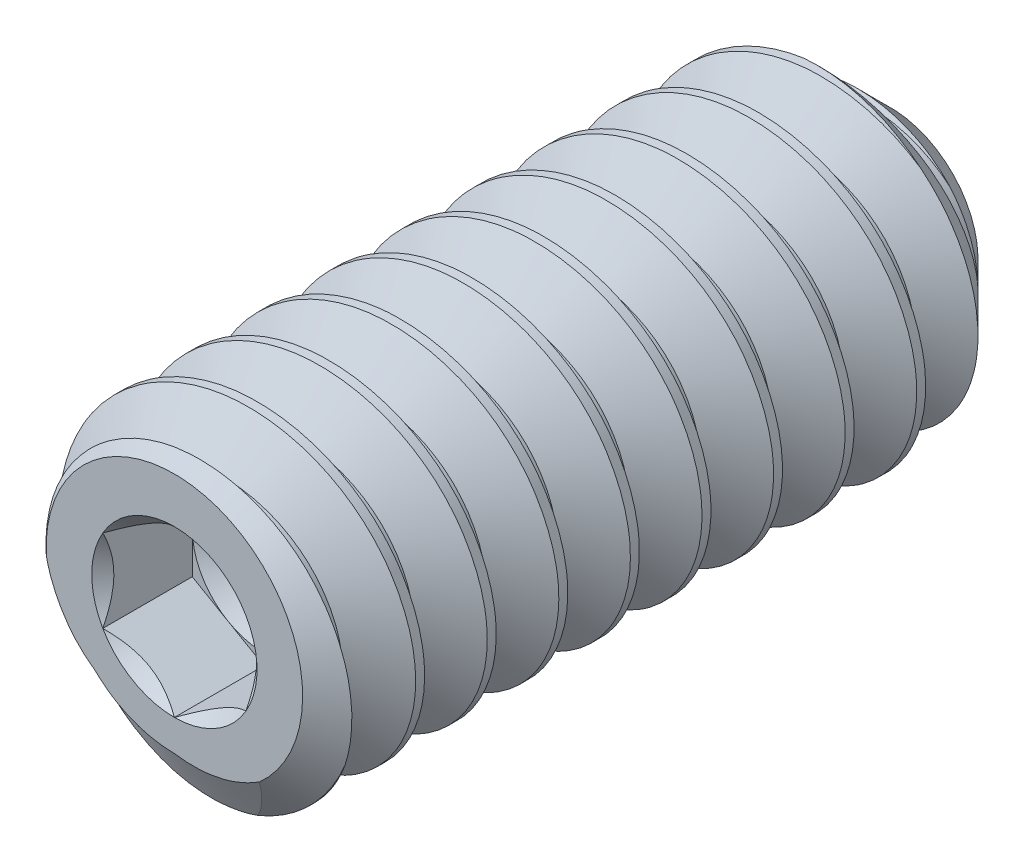
from build123d import *

# Parameters (mm, degrees)
CUT_SWEEP2_PITCH    = 0.635
CUT_EXTRUDE10_DEPTH = 0.79375


with BuildPart() as part:
    # Sketch22 → Revolve1 (revolve)
    with BuildSketch(Plane(origin=(0, 0, 0), x_dir=(0, 0, -1), z_dir=(1, 0, 0)), mode=Mode.PRIVATE) as revolve1_sk:
        Polygon((-2.940837021, 0), (-2.940837021, 1.13792), (-2.741641981, 1.4224), (2.766188262, 1.4224), (3.409162979, 0.779425283), (3.409162979, 0), (2.940837021, 0), align=None)
    revolve(revolve1_sk.sketch.rotate(Axis((0, 0, -2.940837021), (0, 0, -1)), 180), axis=Axis((0, 0, -2.940837021), (0, 0, -1)))

    # Cut-Sweep2: the profile of Sketch28 profile screwed along a right-hand helix of 11 turns, 6 arcs to a turn; built about Z, then put on its axis
    cut_sweep2_z = Axis((0, 0, 0), (0, 0, 1))
    cut_sweep2_corners = [(1.4227, 0, 0.000173205), (1.4227, 0, -0.555798205), (1.009955401, 0, -0.3175), (1.009955401, 0, -0.238125)]
    with BuildLine(mode=Mode.PRIVATE) as cut_sweep2_profile:
        Line(cut_sweep2_corners[0], cut_sweep2_corners[1])
        Line(cut_sweep2_corners[1], cut_sweep2_corners[2])
        Line(cut_sweep2_corners[2], cut_sweep2_corners[3])
        Line(cut_sweep2_corners[3], cut_sweep2_corners[0])
    cut_sweep2_cap = Face(cut_sweep2_profile.wire())
    cut_sweep2_turn_angles = [0, 30, 60, 90, 120, 150, 180, 210, 240, 270, 300, 330, 360]
    cut_sweep2_turn_weights = [1, 0.8660254037844387, 1, 0.8660254037844387, 1, 0.8660254037844387, 1, 0.8660254037844387, 1, 0.8660254037844387, 1, 0.8660254037844387, 1]
    cut_sweep2_turn_rails = [Edge.make_bspline([Vector(p[0], p[1], 0).rotate(cut_sweep2_z, cut_sweep2_turn_angles[k]) / cut_sweep2_turn_weights[k] + Vector(0, 0, p[2] + CUT_SWEEP2_PITCH * cut_sweep2_turn_angles[k] / 360) for k in range(13)], [0, 0, 0, 1, 1, 2, 2, 3, 3, 4, 4, 5, 5, 6, 6, 6], 2, cut_sweep2_turn_weights) for p in cut_sweep2_corners]
    cut_sweep2_turn_sides = [Face.make_surface_from_curves(cut_sweep2_turn_rails[p[0]], cut_sweep2_turn_rails[p[1]]) for p in [(0, 1), (1, 2), (2, 3), (3, 0)]]
    cut_sweep2 = Plane(origin=(0, 0, -3.409162979), x_dir=(0, 1, 0), z_dir=(0, 0, 1)) * Solid(Shell([*[p.moved(Location((0, 0, CUT_SWEEP2_PITCH * i))) for i in range(11) for p in cut_sweep2_turn_sides], cut_sweep2_cap, cut_sweep2_cap.rotate(cut_sweep2_z, 3960).moved(Location((0, 0, CUT_SWEEP2_PITCH * 3960 / 360)))]))
    add(cut_sweep2, mode=Mode.SUBTRACT)

    # Sketch23 → Cut-Extrude10 (cut)
    with BuildSketch(Plane.XY.offset(2.940837021)):
        Polygon((0, 0.733234842), (-0.635, 0.366617421), (-0.635, -0.366617421), (0, -0.733234842), (0.635, -0.366617421), (0.635, 0.366617421), align=None)
    extrude(amount=-CUT_EXTRUDE10_DEPTH, mode=Mode.SUBTRACT)

    # Cut-Extrude11 cone 1 section (through the dimple's axis) → Cut-Extrude11 (revolve, cut)
    with BuildSketch(Plane(origin=(0, 0, 2.940837021), x_dir=(0, -1, 0), z_dir=(1, 0, 0))):
        Polygon((0, 0), (0.733234842, 0), (0, 0.733234842), align=None)
    revolve(axis=Axis((0, 0, 2.940837021), (0, 0, -1)), mode=Mode.SUBTRACT)

    # Cut-Extrude12 cone 1 section (through the dimple's axis) → Cut-Extrude12 (revolve, cut)
    with BuildSketch(Plane(origin=(0, 0, 2.147087021), x_dir=(0, -1, 0), z_dir=(1, 0, 0))):
        Polygon((0, 0), (0.635, 0), (0, 0.366617421), align=None)
    revolve(axis=Axis((0, 0, 2.147087021), (0, 0, -1)), mode=Mode.SUBTRACT)


solid = part.part
